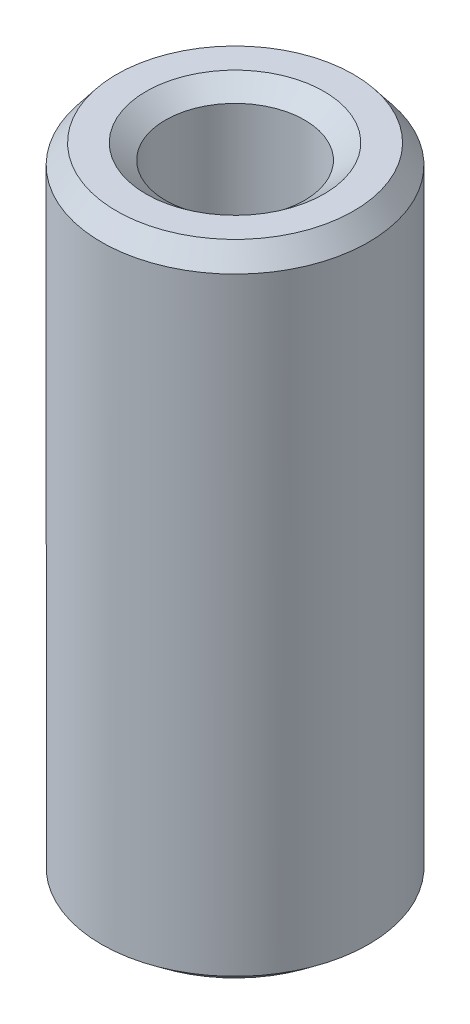
from build123d import *
from OCP.BRepFilletAPI import BRepFilletAPI_MakeChamfer

# Parameters (mm, degrees)
SKETCH1_R           = 12.5
BOSS_EXTRUDE1_DEPTH = 60.133722674
SKETCH2_R           = 6.51351291
CUT_EXTRUDE1_DEPTH  = 63.678262601
CHAMFER1_SIZE       = 1.810763003
CHAMFER1_SIZE2      = 1.415527895


with BuildPart() as part:
    # Sketch1 → Boss-Extrude1 (new body)
    with BuildSketch(Plane(origin=(0, 0, 0), x_dir=(1, 0, 0), z_dir=(0, 1, 0))):
        Circle(SKETCH1_R)
    extrude(amount=BOSS_EXTRUDE1_DEPTH)

    # Sketch2 → Cut-Extrude1 (cut, through all)
    with BuildSketch(Plane(origin=(0, 0, 0), x_dir=(1, 0, 0), z_dir=(0, 1, 0))):
        Circle(SKETCH2_R)
    extrude(amount=CUT_EXTRUDE1_DEPTH, mode=Mode.SUBTRACT)

    # Chamfer1: one chamfer whose edges measure the first distance from different faces: ONE call of the kernel's chamfer builder (chamfer() names one face for all edges)
    chamfer1_edges_1 = [part.edges().sort_by_distance(p)[0] for p in [
        (-6.51351291, 60.133722674, 0),
    ]]
    chamfer1_side_1 = [part.faces().sort_by_distance(p)[0] for p in [
        (-12.146446609, 60.133722674, 0),
    ]]
    chamfer1_edges_2 = [part.edges().sort_by_distance(p)[0] for p in [
        (-6.51351291, 0, 0),
    ]]
    chamfer1_side_2 = [part.faces().sort_by_distance(p)[0] for p in [
        (-6.51351291, 30.066861337, 0),
    ]]
    chamfer1_edges_3 = [part.edges().sort_by_distance(p)[0] for p in [
        (-12.5, 0, 0),
    ]]
    chamfer1_side_3 = [part.faces().sort_by_distance(p)[0] for p in [
        (-12.146446609, 0, 0),
    ]]
    chamfer1_edges_4 = [part.edges().sort_by_distance(p)[0] for p in [
        (-12.5, 60.133722674, 0),
    ]]
    chamfer1_side_4 = [part.faces().sort_by_distance(p)[0] for p in [
        (-12.5, 30.066861337, 0),
    ]]
    chamfer1 = BRepFilletAPI_MakeChamfer(part.part.solid().wrapped)
    for e in chamfer1_edges_1:
        chamfer1.Add(CHAMFER1_SIZE, CHAMFER1_SIZE2, e.wrapped, chamfer1_side_1[0].wrapped)  # the first distance lies on this face
    for e in chamfer1_edges_2:
        chamfer1.Add(CHAMFER1_SIZE, CHAMFER1_SIZE2, e.wrapped, chamfer1_side_2[0].wrapped)  # the first distance lies on this face
    for e in chamfer1_edges_3:
        chamfer1.Add(CHAMFER1_SIZE, CHAMFER1_SIZE2, e.wrapped, chamfer1_side_3[0].wrapped)  # the first distance lies on this face
    for e in chamfer1_edges_4:
        chamfer1.Add(CHAMFER1_SIZE, CHAMFER1_SIZE2, e.wrapped, chamfer1_side_4[0].wrapped)  # the first distance lies on this face
    add(Compound.cast(chamfer1.Shape()), mode=Mode.REPLACE)


solid = part.part
